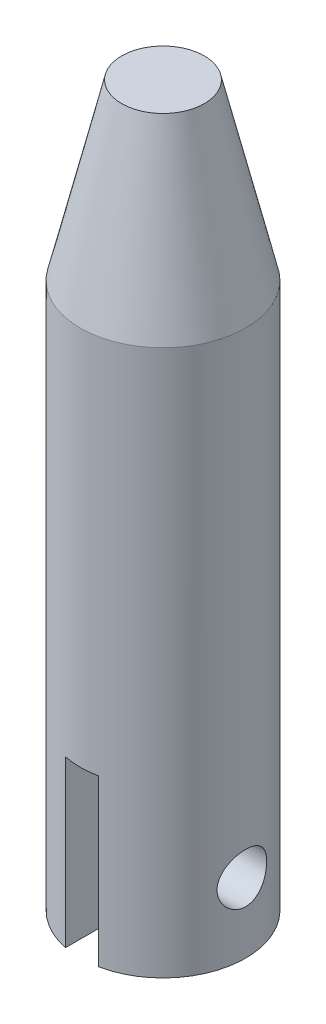
from build123d import *

# Parameters (mm, degrees)
CROQUIS1_R                             = 5
SALIENTE_EXTRUIR1_DEPTH                = 43.5
CORTAR_EXTRUIR1_REACH                  = 46.071
CORTAR_EXTRUIR1_END_RADIUS             = 5
CROQUIS8_R                             = 1.5
CORTAR_EXTRUIR1_DIRECTION_2_REACH      = 46.071
CORTAR_EXTRUIR1_DIRECTION_2_END_RADIUS = 5
CORTAR_EXTRUIR2_REACH                  = 46.071
CROQUIS9_W                             = 2
CROQUIS9_H                             = 10
CORTAR_EXTRUIR2_DIRECTION_2_REACH      = 46.071


# Read off the part's stored shape, not the designer's step: Cortar-Revolución-Lámina1
with BuildPart() as part:
    # Croquis1 → Saliente-Extruir1 (new body)
    with BuildSketch(Plane(origin=(0, 0, 0), x_dir=(1, 0, 0), z_dir=(0, 1, 0))):
        with Locations(Location((0, 0, 0), (0, 0, 270))):
            Circle(CROQUIS1_R)
    extrude(amount=SALIENTE_EXTRUIR1_DEPTH)

    # Cortar-Revolución-Lámina1 outline → Cortar-Revolución-Lámina1 (revolve, cut)
    with BuildSketch(Plane.XY):
        Polygon((5, 43.5), (2.5, 43.5), (5, 33), align=None)
    revolve(axis=Axis((0, 0, 0), (0, 1, 0)), mode=Mode.SUBTRACT)

    # Cortar-Extruir1: up to this cylinder (the profile starts inside it)
    cortar_extruir1_end = Plane(origin=(0, 4.2, 0), z_dir=(0, -1, 0)) * Cylinder(CORTAR_EXTRUIR1_END_RADIUS, 103.142, mode=Mode.PRIVATE)
    # Croquis8 → Cortar-Extruir1 (cut, up to the surface)
    with BuildSketch(Plane(origin=(0, 0, 0), x_dir=(0, 0, -1), z_dir=(1, 0, 0)), mode=Mode.PRIVATE) as cortar_extruir1_sk1:
        with Locations(Location((0, 4.2, 0), (0, 0, 180))):
            Circle(CROQUIS8_R)
    cortar_extruir1_tool1 = extrude(cortar_extruir1_sk1.sketch, amount=-CORTAR_EXTRUIR1_REACH, mode=Mode.PRIVATE) & cortar_extruir1_end
    add(cortar_extruir1_tool1.solids().sort_by_distance((0, 4.2, 0))[0], mode=Mode.SUBTRACT)

    # Cortar-Extruir1 direction 2: up to this cylinder (the profile starts inside it)
    cortar_extruir1_direction_2_end = Plane(origin=(0, 4.2, 0), z_dir=(0, -1, 0)) * Cylinder(CORTAR_EXTRUIR1_DIRECTION_2_END_RADIUS, 103.142, mode=Mode.PRIVATE)
    # Croquis8 → Cortar-Extruir1 direction 2 (cut, up to the surface)
    with BuildSketch(Plane(origin=(0, 0, 0), x_dir=(0, 0, -1), z_dir=(1, 0, 0)), mode=Mode.PRIVATE) as cortar_extruir1_direction_2_sk1:
        with Locations(Location((0, 4.2, 0), (0, 0, 180))):
            Circle(CROQUIS8_R)
    cortar_extruir1_direction_2_tool1 = extrude(cortar_extruir1_direction_2_sk1.sketch, amount=CORTAR_EXTRUIR1_DIRECTION_2_REACH, mode=Mode.PRIVATE) & cortar_extruir1_direction_2_end
    add(cortar_extruir1_direction_2_tool1.solids().sort_by_distance((0, 4.2, 0))[0], mode=Mode.SUBTRACT)

    # Croquis9 → Cortar-Extruir2 (cut, up to next)
    with BuildSketch(Plane.XY, mode=Mode.PRIVATE) as cortar_extruir2_sk1:
        with Locations((0, 5)):
            Rectangle(CROQUIS9_W, CROQUIS9_H)
    cortar_extruir2_tool1 = extrude(cortar_extruir2_sk1.sketch, amount=-CORTAR_EXTRUIR2_REACH, mode=Mode.PRIVATE) & part.part
    add(cortar_extruir2_tool1.solids().sort_by_distance((0, 5, 0))[0], mode=Mode.SUBTRACT)

    # Croquis9 → Cortar-Extruir2 direction 2 (cut, up to next)
    with BuildSketch(Plane.XY, mode=Mode.PRIVATE) as cortar_extruir2_direction_2_sk1:
        with Locations((0, 5)):
            Rectangle(CROQUIS9_W, CROQUIS9_H)
    cortar_extruir2_direction_2_tool1 = extrude(cortar_extruir2_direction_2_sk1.sketch, amount=CORTAR_EXTRUIR2_DIRECTION_2_REACH, mode=Mode.PRIVATE) & part.part
    add(cortar_extruir2_direction_2_tool1.solids().sort_by_distance((0, 5, 0))[0], mode=Mode.SUBTRACT)


solid = part.part
